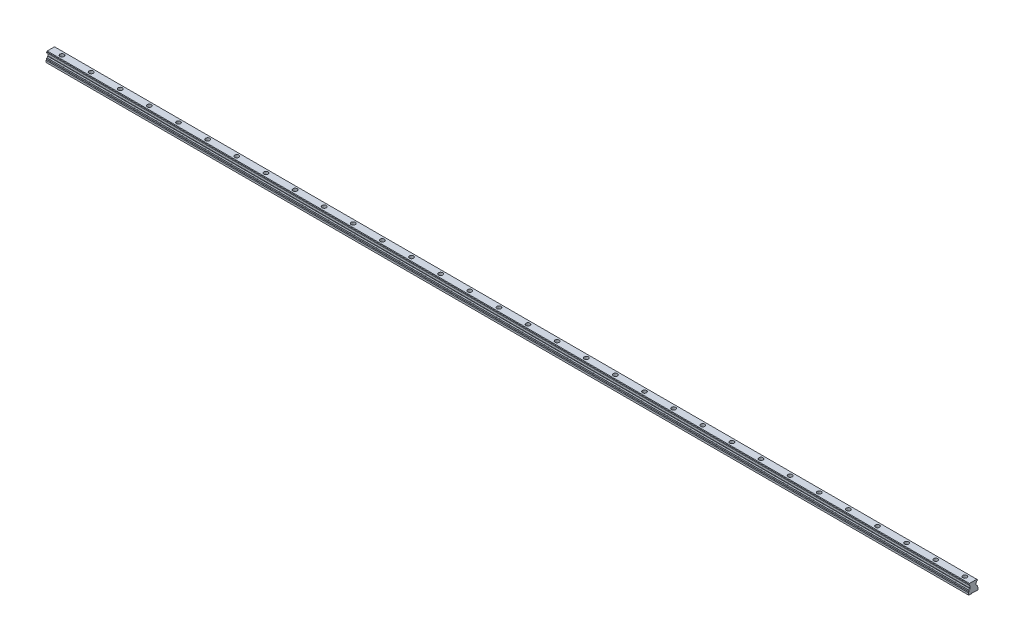
from build123d import *

# Parameters (mm, degrees)
BOSS_EXTRUDE5_DEPTH = 1900
SKETCH8_R           = 4.25
CUT_EXTRUDE1_DEPTH  = 9
SKETCH9_R           = 3
CUT_EXTRUDE2_DEPTH  = 1959.558127807
LPATTERN1_COUNT     = 35
LPATTERN1_PITCH     = 60


with BuildPart() as part:
    # Sketch7 → Boss-Extrude5 (new body)
    with BuildSketch(Plane(origin=(58.5, 0, 0), x_dir=(0, 0, -1), z_dir=(1, 0, 0))):
        with BuildLine():
            Line((-7.709038211, 8.883084864), (-8.5, 8.601077183))
            Line((-8.5, 8.601077183), (-8.5, 6.104700538))
            ThreePointArc((-8.5, 6.104700538), (-8.566987298, 5.854700538), (-8.75, 5.671687836))
            Line((-8.75, 5.671687836), (-10, 4.95))
            Line((-10, 4.95), (-10, 1))
            Line((-10, 1), (-9, 0))
            Line((-9, 0), (-4, 0))
            Line((-4, 0), (-3.5, 0.5))
            Line((-3.5, 0.5), (3.5, 0.5))
            Line((3.5, 0.5), (4, 0))
            Line((4, 0), (9, 0))
            Line((9, 0), (10, 1))
            Line((10, 1), (10, 4.95))
            Line((10, 4.95), (8.75, 5.671687836))
            ThreePointArc((8.75, 5.671687836), (8.566987298, 5.854700538), (8.5, 6.104700538))
            Line((8.5, 6.104700538), (8.5, 8.46691323))
            Line((8.5, 8.46691323), (8.084678947, 8.882234283))
            ThreePointArc((8.084678947, 8.882234283), (6.941822875, 9.249266637), (6.503340774, 10.366659226))
            Line((6.503340774, 10.366659226), (6, 10.87))
            Line((6, 10.87), (6, 14.93))
            Line((6, 14.93), (6.503340774, 15.433340774))
            ThreePointArc((6.503340774, 15.433340774), (6.813545517, 16.412959034), (7.709038211, 16.916915136))
            Line((7.709038211, 16.916915136), (8.5, 17.198922817))
            Line((8.5, 17.198922817), (8.5, 19.3))
            Line((8.5, 19.3), (7.5, 20.3))
            Line((7.5, 20.3), (-7.5, 20.3))
            Line((-7.5, 20.3), (-8.5, 19.3))
            Line((-8.5, 19.3), (-8.5, 17.33308677))
            Line((-8.5, 17.33308677), (-8.084678947, 16.917765717))
            ThreePointArc((-8.084678947, 16.917765717), (-6.941822875, 16.550733363), (-6.503340774, 15.433340774))
            Line((-6.503340774, 15.433340774), (-6, 14.93))
            Line((-6, 14.93), (-6, 10.87))
            Line((-6, 10.87), (-6.503340774, 10.366659226))
            ThreePointArc((-6.503340774, 10.366659226), (-6.813545517, 9.387040966), (-7.709038211, 8.883084864))
        make_face()
    extrude(amount=BOSS_EXTRUDE5_DEPTH)

    # Sketch8 → Cut-Extrude1 (cut)
    with BuildSketch(Plane(origin=(0, 20.3, 0), x_dir=(1, 0, 0), z_dir=(0, 1, 0))):
        with Locations((1941.491679108, 0)):
            Circle(SKETCH8_R)
    cut_extrude1 = extrude(amount=-CUT_EXTRUDE1_DEPTH, mode=Mode.SUBTRACT)

    # Sketch9 → Cut-Extrude2 (cut, through all)
    with BuildSketch(Plane(origin=(0, 11.3, 0), x_dir=(1, 0, 0), z_dir=(0, 1, 0))):
        with Locations((1941.491679108, 0)):
            Circle(SKETCH9_R)
    cut_extrude2 = extrude(amount=-CUT_EXTRUDE2_DEPTH, mode=Mode.SUBTRACT)

    # LPattern1: Cut-Extrude1, Cut-Extrude2 ×35
    with Locations(*[(-i * LPATTERN1_PITCH, 0, 0) for i in range(1, LPATTERN1_COUNT)]):
        add(cut_extrude1, mode=Mode.SUBTRACT)
        add(cut_extrude2, mode=Mode.SUBTRACT)


solid = part.part
